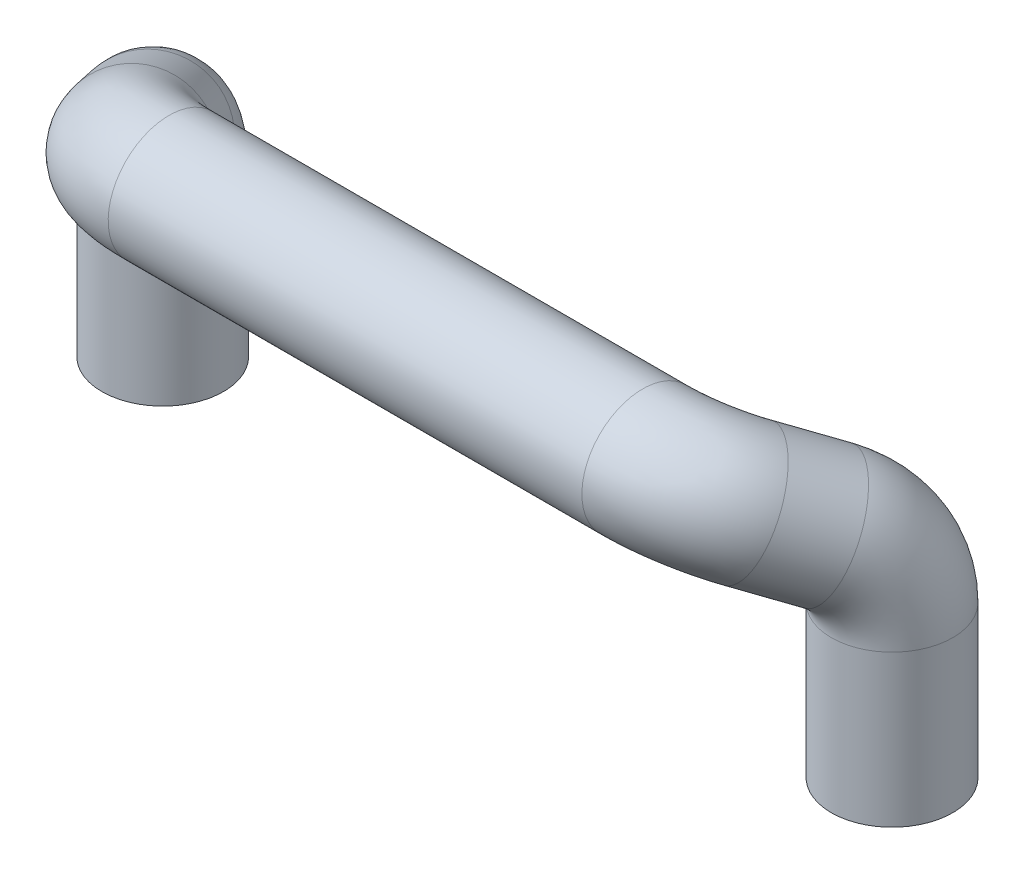
from build123d import *

# Parameters (mm, degrees)
SWEEP_8_PROFILE_R = 7.5


with BuildPart() as part:
    # 扫描8: sweep along a curve in space
    with BuildLine() as sweep_8_path:
        Line((65, -25, 0), (65, -6.29015931, 0))
        ThreePointArc((65, -6.29015931, 0), (64.148352046, -0.965747145, 1.277471931), (61.854920345, 2.723718878, 4.717619483))
        Line((61.854920345, 2.723718878, 4.717619483), (57.886751346, 6.160254038, 10.669872981))
        ThreePointArc((49.226497308, 8.660254038, 15), (54.226497308, 7.990381057, 13.839745962), (57.886751346, 6.160254038, 10.669872981))
        Line((49.226497308, 8.660254038, 15), (-9.226497308, 8.660254038, 15))
        ThreePointArc((-9.226497308, 8.660254038, 15), (-14.226497308, 7.990381057, 13.839745962), (-17.886751346, 6.160254038, 10.669872981))
        Line((-17.886751346, 6.160254038, 10.669872981), (-21.854920345, 2.723718878, 4.717619483))
        ThreePointArc((-25, -6.29015931, 0), (-24.148352046, -0.965747145, 1.277471931), (-21.854920345, 2.723718878, 4.717619483))
        Line((-25, -6.29015931, 0), (-25, -25, 0))
    # 扫描8 profile (on start of the path) → 扫描8 (sweep)
    with BuildSketch(Plane(origin=(65, -25, 0), x_dir=(0, 0, 1), z_dir=(0, 1, 0))):
        Circle(SWEEP_8_PROFILE_R)
    sweep(path=sweep_8_path.line)


solid = part.part
